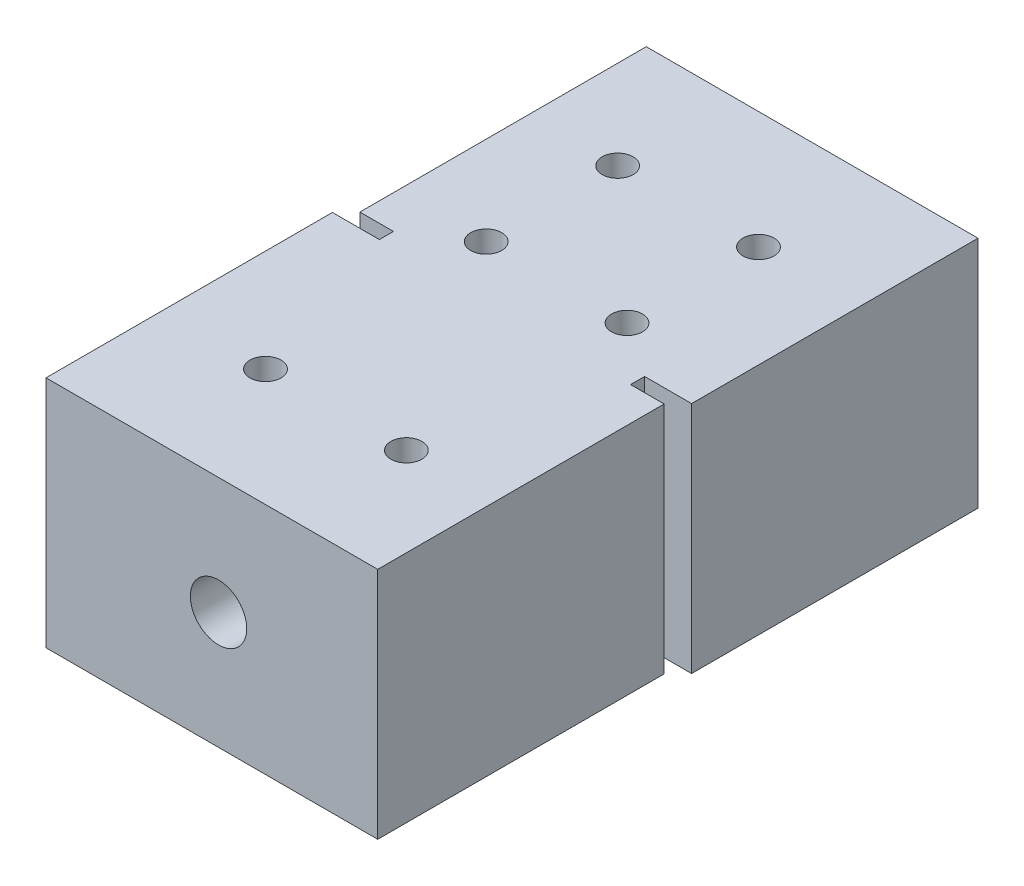
from build123d import *

# Parameters (mm, degrees)
SKETCH1_W                 = 73.5
SKETCH1_H                 = 49.8
SLIDER_BODY_DEPTH         = 125
SKETCH2_R                 = 11
LEAD_NUT_INSET_DEPTH      = 15
SKETCH3_R                 = 6
LEADSCREW_CLEARANCE_DEPTH = 142.358728064
SKETCH9_W                 = 10
SKETCH9_H                 = 3
DECOUPLING_SLIT_DEPTH     = 154.320872682
BOLT_CLEARANCE_HOLES_D    = 6.6
SKETCH10_W                = 2.85
SKETCH10_H                = 61
NEOPRENE_INLAY_DEPTH      = 154.320872682


with BuildPart() as part:
    # Sketch1 → slider body (new body)
    with BuildSketch(Plane.XY):
        with Locations((36.75, 24.9)):
            Rectangle(SKETCH1_W, SKETCH1_H)
    extrude(amount=SLIDER_BODY_DEPTH)

    # Sketch2 → lead nut inset (cut)
    with BuildSketch(Plane(origin=(0, 0, 0), x_dir=(-1, 0, 0), z_dir=(0, 0, -1))):
        with Locations((-36.75, 24.9)):
            Circle(SKETCH2_R)
    extrude(amount=-LEAD_NUT_INSET_DEPTH, mode=Mode.SUBTRACT)

    # Sketch3 → leadscrew clearance (cut, through all)
    with BuildSketch(Plane(origin=(0, 0, 15), x_dir=(-1, 0, 0), z_dir=(0, 0, -1))):
        with Locations((-36.75, 24.9)):
            Circle(SKETCH3_R)
    extrude(amount=-LEADSCREW_CLEARANCE_DEPTH, mode=Mode.SUBTRACT)

    # Sketch9 → decoupling slit (cut, through all)
    with BuildSketch(Plane.XZ):
        with Locations((68.5, 62.5)):
            Rectangle(SKETCH9_W, SKETCH9_H)
    decoupling_slit = extrude(amount=-DECOUPLING_SLIT_DEPTH, mode=Mode.SUBTRACT)

    # bolt clearance holes (through all)
    with Locations(Plane(origin=(0, 49.8, 0), x_dir=(1, 0, 0), z_dir=(0, 1, 0))):
        with Locations((51.75, -100), (21.75, -25), (51.75, -25), (21.75, -100), (21.75, -53), (51.75, -53)):
            Hole(BOLT_CLEARANCE_HOLES_D / 2)

    # mirror slit: decoupling slit across plane
    add(decoupling_slit.mirror(Plane.ZY.offset(-36.75)), mode=Mode.SUBTRACT)

    # Sketch10 → neoprene inlay (cut, through all)
    with BuildSketch(Plane.XZ):
        with Locations((72.075, 94.5)):
            Rectangle(SKETCH10_W, SKETCH10_H)
        with Locations((1.425, 30.5)):
            Rectangle(SKETCH10_W, SKETCH10_H)
    extrude(amount=-NEOPRENE_INLAY_DEPTH, mode=Mode.SUBTRACT)


solid = part.part
